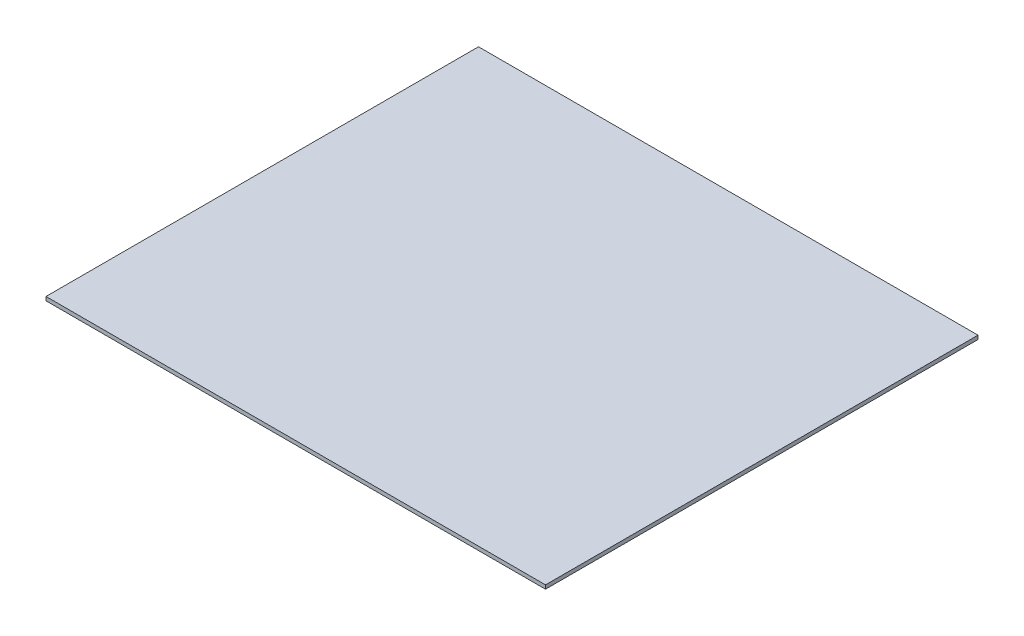
from build123d import *

# Parameters (mm, degrees)
SKETCH1_W           = 790
SKETCH1_H           = 342
BOSS_EXTRUDE1_DEPTH = 3
SPLIT1_START        = -96.972176759
SPLIT1_OUTLINE_W    = 3
SPLIT1_OUTLINE_H    = 342
SPLIT1_DEPTH        = 395


# Read off the part's stored shape, not the designer's step: Split1
with BuildPart() as part:
    # Sketch1 → Boss-Extrude1 (new body)
    with BuildSketch(Plane(origin=(0, 0, 0), x_dir=(1, 0, 0), z_dir=(0, 1, 0))):
        with Locations((-96.972176759, -14.5400982)):
            Rectangle(SKETCH1_W, SKETCH1_H)
    extrude(amount=BOSS_EXTRUDE1_DEPTH)

    # Split1 outline → Split1 (cut)
    with BuildSketch(Plane.YZ.offset(SPLIT1_START)):
        with Locations((1.5, 14.5400982)):
            Rectangle(SPLIT1_OUTLINE_W, SPLIT1_OUTLINE_H)
    extrude(amount=SPLIT1_DEPTH, mode=Mode.SUBTRACT)


solid = part.part
